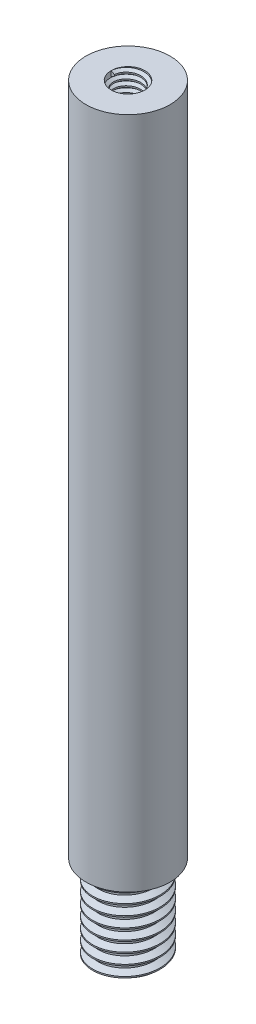
from build123d import *
from build123d.topology import SkipClean

# Parameters (mm, degrees)
SKETCH2_R           = 5
BOSS_EXTRUDE1_DEPTH = 90
SKETCH3_OUTSIDE_W   = 30.22
SKETCH3_OUTSIDE_H   = 30.22
SKETCH3_OUTSIDE_R   = 4
CUT_EXTRUDE2_DEPTH  = 10
SKETCH4_R           = 2
CUT_EXTRUDE3_DEPTH  = 10
THREAD2_PITCH       = 1.25
THREAD4_PITCH       = 0.7
CUT_EXTRUDE9_DEPTH  = 91.27752321


with BuildPart() as part:
    # Sketch2 → Boss-Extrude1 (new body)
    with BuildSketch(Plane(origin=(0, 0, 0), x_dir=(1, 0, 0), z_dir=(0, 1, 0))):
        with Locations(Location((0, 0, 0), (0, 0, 90))):
            Circle(SKETCH2_R)
    extrude(amount=BOSS_EXTRUDE1_DEPTH)

    # Sketch3 outside → Cut-Extrude2 (cut)
    with BuildSketch(Plane.XZ):
        Rectangle(SKETCH3_OUTSIDE_W, SKETCH3_OUTSIDE_H)
        with Locations(Location((0, 0, 0), (0, 0, 270))):
            Circle(SKETCH3_OUTSIDE_R, mode=Mode.SUBTRACT)
    extrude(amount=-CUT_EXTRUDE2_DEPTH, mode=Mode.SUBTRACT)

    # Sketch4 → Cut-Extrude3 (cut)
    with BuildSketch(Plane(origin=(0, 90, 0), x_dir=(1, 0, 0), z_dir=(0, 1, 0))):
        with Locations(Location((0, 0, 0), (0, 0, 270))):
            Circle(SKETCH4_R)
    extrude(amount=-CUT_EXTRUDE3_DEPTH, mode=Mode.SUBTRACT)

    # Thread2: the profile of Thread Profile2 profile screwed along a right-hand helix of 8 turns, 8 arcs to a turn; built about Z, then put on its axis
    thread2_z = Axis((0, 0, 0), (0, 0, 1))
    thread2_corners = [(4.0003, 0, -0.000173205), (4.0003, 0, 1.093923202), (3.323417656, 0, 0.703124998), (3.323417656, 0, 0.390624998)]
    with BuildLine(mode=Mode.PRIVATE) as thread2_profile:
        Line(thread2_corners[0], thread2_corners[1])
        Line(thread2_corners[1], thread2_corners[2])
        Line(thread2_corners[2], thread2_corners[3])
        Line(thread2_corners[3], thread2_corners[0])
    thread2_cap = Face(thread2_profile.wire())
    thread2_turn_angles = [0, 22.5, 45, 67.5, 90, 112.5, 135, 157.5, 180, 202.5, 225, 247.5, 270, 292.5, 315, 337.5, 360]
    thread2_turn_weights = [1, 0.9238795325112867, 1, 0.9238795325112867, 1, 0.9238795325112867, 1, 0.9238795325112867, 1, 0.9238795325112867, 1, 0.9238795325112867, 1, 0.9238795325112867, 1, 0.9238795325112867, 1]
    thread2_turn_rails = [Edge.make_bspline([Vector(p[0], p[1], 0).rotate(thread2_z, thread2_turn_angles[k]) / thread2_turn_weights[k] + Vector(0, 0, p[2] + THREAD2_PITCH * thread2_turn_angles[k] / 360) for k in range(17)], [0, 0, 0, 1, 1, 2, 2, 3, 3, 4, 4, 5, 5, 6, 6, 7, 7, 8, 8, 8], 2, thread2_turn_weights) for p in thread2_corners]
    thread2_turn_sides = [Face.make_surface_from_curves(thread2_turn_rails[p[0]], thread2_turn_rails[p[1]]) for p in [(0, 1), (1, 2), (2, 3), (3, 0)]]
    thread2 = Plane(origin=(0, 10, 0), x_dir=(-1, 0, 0), z_dir=(0, -1, 0)) * Solid(Shell([*[p.moved(Location((0, 0, THREAD2_PITCH * i))) for i in range(8) for p in thread2_turn_sides], thread2_cap, thread2_cap.rotate(thread2_z, 2880).moved(Location((0, 0, THREAD2_PITCH * 2880 / 360)))]))
    add(thread2, mode=Mode.SUBTRACT)

    # Thread4: the profile of Thread Profile4 profile screwed along a right-hand helix of 39.75 turns, 6 arcs to a turn; built about Z, then put on its axis
    with SkipClean():  # the faces are left unmerged after this step: merging them gives an invalid solid
        thread4_z = Axis((0, 0, 0), (0, 0, 1))
        thread4_corners = [(2.0003, 0, -0.000173205), (2.0003, 0, 0.612673203), (1.621113887, 0, 0.393749999), (1.621113887, 0, 0.218749999)]
        with BuildLine(mode=Mode.PRIVATE) as thread4_profile:
            Line(thread4_corners[0], thread4_corners[1])
            Line(thread4_corners[1], thread4_corners[2])
            Line(thread4_corners[2], thread4_corners[3])
            Line(thread4_corners[3], thread4_corners[0])
        thread4_cap = Face(thread4_profile.wire())
        thread4_turn_angles = [0, 30, 60, 90, 120, 150, 180, 210, 240, 270, 300, 330, 360]
        thread4_turn_weights = [1, 0.8660254037844387, 1, 0.8660254037844387, 1, 0.8660254037844387, 1, 0.8660254037844387, 1, 0.8660254037844387, 1, 0.8660254037844387, 1]
        thread4_turn_rails = [Edge.make_bspline([Vector(p[0], p[1], 0).rotate(thread4_z, thread4_turn_angles[k]) / thread4_turn_weights[k] + Vector(0, 0, p[2] + THREAD4_PITCH * thread4_turn_angles[k] / 360) for k in range(13)], [0, 0, 0, 1, 1, 2, 2, 3, 3, 4, 4, 5, 5, 6, 6, 6], 2, thread4_turn_weights) for p in thread4_corners]
        thread4_turn_sides = [Face.make_surface_from_curves(thread4_turn_rails[p[0]], thread4_turn_rails[p[1]]) for p in [(0, 1), (1, 2), (2, 3), (3, 0)]]
        thread4_turn = Solid(Shell([*thread4_turn_sides, thread4_cap, thread4_cap.rotate(thread4_z, 360).moved(Location((0, 0, THREAD4_PITCH * 360 / 360)))]))
        thread4_last_angles = [14040, 14070, 14100, 14130, 14160, 14190, 14220, 14250, 14280, 14295, 14310]
        thread4_last_weights = [1, 0.8660254037844387, 1, 0.8660254037844387, 1, 0.8660254037844387, 1, 0.8660254037844387, 1, 0.9659258262890683, 1]
        thread4_last_rails = [Edge.make_bspline([Vector(p[0], p[1], 0).rotate(thread4_z, thread4_last_angles[k]) / thread4_last_weights[k] + Vector(0, 0, p[2] + THREAD4_PITCH * thread4_last_angles[k] / 360) for k in range(11)], [0, 0, 0, 1, 1, 2, 2, 3, 3, 4, 4, 5, 5, 5], 2, thread4_last_weights) for p in thread4_corners]
        thread4_last_sides = [Face.make_surface_from_curves(thread4_last_rails[p[0]], thread4_last_rails[p[1]]) for p in [(0, 1), (1, 2), (2, 3), (3, 0)]]
        thread4_last = Solid(Shell([*thread4_last_sides, thread4_cap.rotate(thread4_z, 14040).moved(Location((0, 0, THREAD4_PITCH * 14040 / 360))), thread4_cap.rotate(thread4_z, 14310).moved(Location((0, 0, THREAD4_PITCH * 14310 / 360)))]))
        thread4_each = [*[thread4_turn.moved(Location((0, 0, THREAD4_PITCH * i))) for i in range(39)], thread4_last]
        add(Plane(origin=(0, 90, 0), x_dir=(-1, 0, 0), z_dir=(0, -1, 0)) * Compound([thread4_each[i] for i in range(0, 40, 2)]))
        add(Plane(origin=(0, 90, 0), x_dir=(-1, 0, 0), z_dir=(0, -1, 0)) * Compound([thread4_each[i] for i in range(1, 40, 2)]))

    # Sketch18 → Cut-Extrude9 (cut, through all)
    with SkipClean():  # the faces are left unmerged after this step: merging them gives an invalid solid
        with BuildSketch(Plane(origin=(0, 0, 0), x_dir=(-1, 0, 0), z_dir=(0, 0, -1))):
            Polygon((4, 10), (3.323417656, 9.609375002), (3.323417656, 9.296875002), (4, 8.906250003), align=None)
        extrude(amount=-CUT_EXTRUDE9_DEPTH, mode=Mode.SUBTRACT)


solid = part.part
